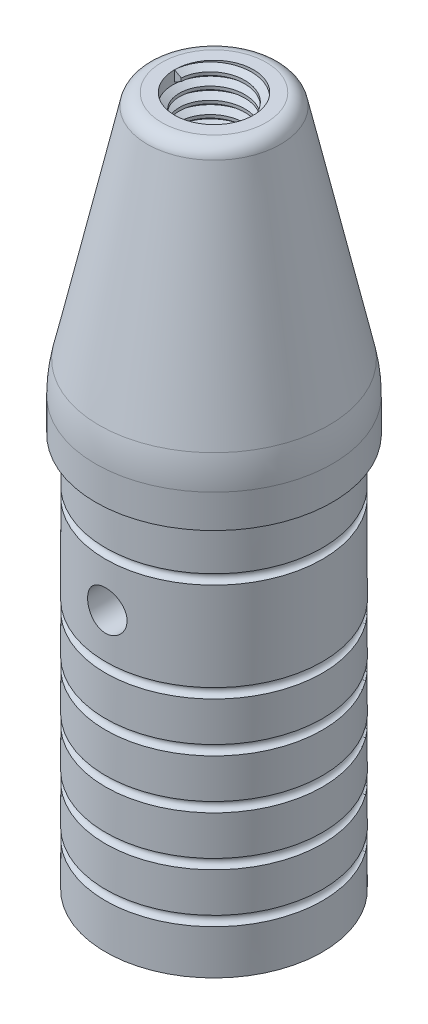
from build123d import *

# Parameters (mm, degrees)
IZIM2_R                 = 4
KES_EKSTR_ZYON1_DEPTH   = 94
RADYUS1_R               = 15
RADYUS2_R               = 1.5
SKETCH1_R               = 0.5
CUT_EXTRUDE1_DEPTH      = 13
CUT_EXTRUDE1_DEPTH_BACK = 13
SKETCH2_R               = 2
THREAD1_PITCH           = 1.25


with BuildPart() as part:
    # Çizim1 → Döndür1 (revolve)
    with BuildSketch(Plane.XY, mode=Mode.PRIVATE) as d_nd_r1_sk:
        Polygon((12, 40), (11, 40), (11, 0), (8, 0), (8, 40), (0, 40), (0, 70), (6.5, 70), (12, 45), align=None)
    revolve(d_nd_r1_sk.sketch.rotate(Axis((0, 0, 0), (0, 1, 0)), 90), axis=Axis((0, 0, 0), (0, 1, 0)))

    # Çizim2 → Kes-Ekstrüzyon1 (cut)
    with BuildSketch(Plane(origin=(0, 70, 0), x_dir=(1, 0, 0), z_dir=(0, 1, 0))):
        with Locations(Location((0, 0, 0), (0, 0, 270))):
            Circle(IZIM2_R)
    extrude(amount=-KES_EKSTR_ZYON1_DEPTH, mode=Mode.SUBTRACT)

    # Radyus1
    radyus1_edges = [part.edges().sort_by_distance(p)[0] for p in [
        (0, 45, 12),
    ]]
    fillet(radyus1_edges, radius=RADYUS1_R)

    # Radyus2
    radyus2_edges = [part.edges().sort_by_distance(p)[0] for p in [
        (0, 70, 6.5),
    ]]
    fillet(radyus2_edges, radius=RADYUS2_R)

    # Sketch1 → Cut-Revolve1 (revolve, cut)
    with BuildSketch(Plane.XY):
        with Locations((11, 35)):
            Circle(SKETCH1_R)
        with Locations((11, 25)):
            Circle(SKETCH1_R)
        with Locations((11, 20)):
            Circle(SKETCH1_R)
        with Locations((11, 15)):
            Circle(SKETCH1_R)
        with Locations((11, 10)):
            Circle(SKETCH1_R)
        with Locations((11, 5)):
            Circle(SKETCH1_R)
    revolve(axis=Axis((0, 0, 0), (0, 1, 0)), mode=Mode.SUBTRACT)

    # Sketch2 → Cut-Extrude1 (cut, two sides: drawn at the far end of the back side and taken through both)
    with BuildSketch(Plane.XY.offset(-CUT_EXTRUDE1_DEPTH_BACK)):
        with Locations(Location((0, 30, 0), (0, 0, 180))):
            Circle(SKETCH2_R)
    extrude(amount=CUT_EXTRUDE1_DEPTH + CUT_EXTRUDE1_DEPTH_BACK, mode=Mode.SUBTRACT)

    # Thread1: the profile of Thread Profile1 profile screwed along a right-hand helix of 24 turns, 8 arcs to a turn; built about Z, then put on its axis
    thread1_z = Axis((0, 0, 0), (0, 0, 1))
    thread1_corners = [(4.0003, 0, -0.000173205), (4.0003, 0, 1.093923202), (3.323417656, 0, 0.703124998), (3.323417656, 0, 0.390624998)]
    with BuildLine(mode=Mode.PRIVATE) as thread1_profile:
        Line(thread1_corners[0], thread1_corners[1])
        Line(thread1_corners[1], thread1_corners[2])
        Line(thread1_corners[2], thread1_corners[3])
        Line(thread1_corners[3], thread1_corners[0])
    thread1_cap = Face(thread1_profile.wire())
    thread1_turn_angles = [0, 22.5, 45, 67.5, 90, 112.5, 135, 157.5, 180, 202.5, 225, 247.5, 270, 292.5, 315, 337.5, 360]
    thread1_turn_weights = [1, 0.9238795325112867, 1, 0.9238795325112867, 1, 0.9238795325112867, 1, 0.9238795325112867, 1, 0.9238795325112867, 1, 0.9238795325112867, 1, 0.9238795325112867, 1, 0.9238795325112867, 1]
    thread1_turn_rails = [Edge.make_bspline([Vector(p[0], p[1], 0).rotate(thread1_z, thread1_turn_angles[k]) / thread1_turn_weights[k] + Vector(0, 0, p[2] + THREAD1_PITCH * thread1_turn_angles[k] / 360) for k in range(17)], [0, 0, 0, 1, 1, 2, 2, 3, 3, 4, 4, 5, 5, 6, 6, 7, 7, 8, 8, 8], 2, thread1_turn_weights) for p in thread1_corners]
    thread1_turn_sides = [Face.make_surface_from_curves(thread1_turn_rails[p[0]], thread1_turn_rails[p[1]]) for p in [(0, 1), (1, 2), (2, 3), (3, 0)]]
    thread1 = Plane(origin=(0, 70, 0), x_dir=(-1, 0, 0), z_dir=(0, -1, 0)) * Solid(Shell([*[p.moved(Location((0, 0, THREAD1_PITCH * i))) for i in range(24) for p in thread1_turn_sides], thread1_cap, thread1_cap.rotate(thread1_z, 8640).moved(Location((0, 0, THREAD1_PITCH * 8640 / 360)))]))
    add(thread1)


solid = part.part
